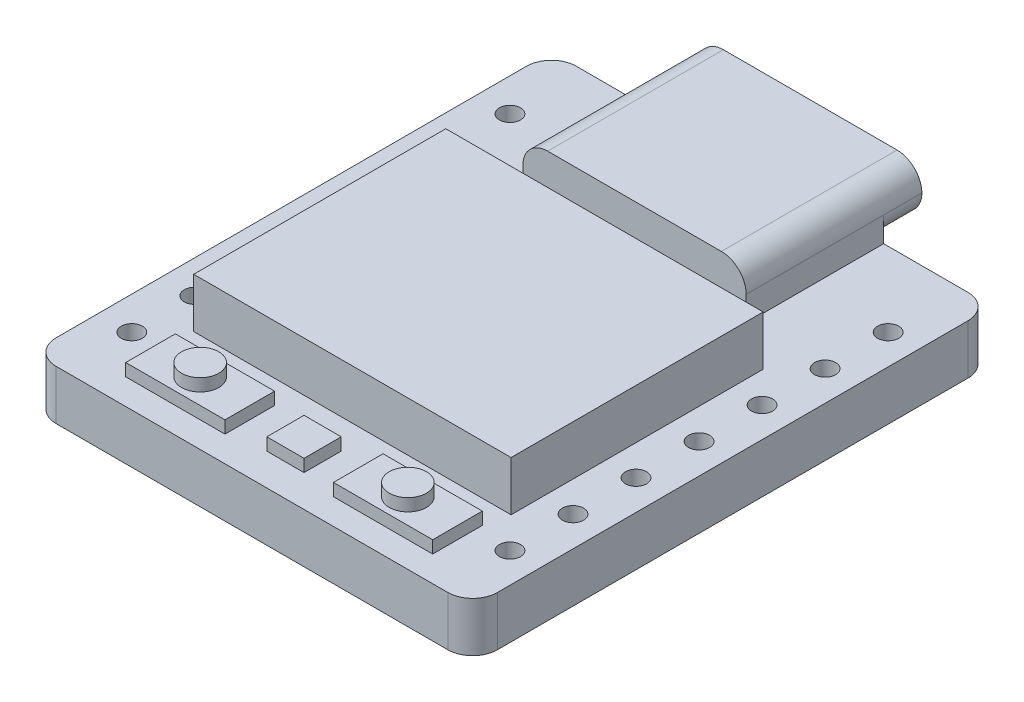
from build123d import *

# Parameters (mm, degrees)
ESQUISSE1_W             = 17.78
ESQUISSE1_H             = 20.955
ESQUISSE1_R             = 0.425
BOSS_EXTRU_1_DEPTH      = 2
BOSS_EXTRU_2_DEPTH      = 2
CONG_1_R                = 1
ESQUISSE3_W             = 6.499332414
ESQUISSE3_H             = 0.15
ENL_V_MAT_EXTRU_1_DEPTH = 4
CONG_2_R                = 1
ESQUISSE4_W             = 12.79
ESQUISSE4_H             = 10.16
BOSS_EXTRU_3_DEPTH      = 2
ESQUISSE5_W             = 4
ESQUISSE5_H             = 2
ESQUISSE5_W_2           = 1.5
ESQUISSE5_H_2           = 1.5
BOSS_EXTRU_4_DEPTH      = 0.5
ESQUISSE6_R             = 0.75
BOSS_EXTRU_5_DEPTH      = 0.5


with BuildPart() as part:
    # Esquisse1 → Boss.-Extru.1 (new body)
    with BuildSketch(Plane(origin=(0, 0, 0), x_dir=(1, 0, 0), z_dir=(0, 1, 0))):
        Rectangle(ESQUISSE1_W, ESQUISSE1_H)
        with Locations(Location((-7.56, 7.4775, 0), (0, 0, 270))):
            Circle(ESQUISSE1_R, mode=Mode.SUBTRACT)
        with Locations(Location((7.68, 7.4775, 0), (0, 0, 270))):
            Circle(ESQUISSE1_R, mode=Mode.SUBTRACT)
        with Locations(Location((7.68, 4.9375, 0), (0, 0, 270))):
            Circle(ESQUISSE1_R, mode=Mode.SUBTRACT)
        with Locations(Location((7.68, 2.3975, 0), (0, 0, 270))):
            Circle(ESQUISSE1_R, mode=Mode.SUBTRACT)
        with Locations(Location((7.68, -0.1425, 0), (0, 0, 270))):
            Circle(ESQUISSE1_R, mode=Mode.SUBTRACT)
        with Locations(Location((7.68, -2.6825, 0), (0, 0, 270))):
            Circle(ESQUISSE1_R, mode=Mode.SUBTRACT)
        with Locations(Location((7.68, -5.2225, 0), (0, 0, 270))):
            Circle(ESQUISSE1_R, mode=Mode.SUBTRACT)
        with Locations(Location((7.68, -7.7625, 0), (0, 0, 270))):
            Circle(ESQUISSE1_R, mode=Mode.SUBTRACT)
        with Locations(Location((-7.56, 4.9375, 0), (0, 0, 270))):
            Circle(ESQUISSE1_R, mode=Mode.SUBTRACT)
        with Locations(Location((-7.56, 2.3975, 0), (0, 0, 270))):
            Circle(ESQUISSE1_R, mode=Mode.SUBTRACT)
        with Locations(Location((-7.56, -0.1425, 0), (0, 0, 270))):
            Circle(ESQUISSE1_R, mode=Mode.SUBTRACT)
        with Locations(Location((-7.56, -2.6825, 0), (0, 0, 270))):
            Circle(ESQUISSE1_R, mode=Mode.SUBTRACT)
        with Locations(Location((-7.56, -5.2225, 0), (0, 0, 270))):
            Circle(ESQUISSE1_R, mode=Mode.SUBTRACT)
        with Locations(Location((-7.56, -7.7625, 0), (0, 0, 270))):
            Circle(ESQUISSE1_R, mode=Mode.SUBTRACT)
    extrude(amount=BOSS_EXTRU_1_DEPTH)

    # Esquisse2 → Boss.-Extru.2 (add)
    with BuildSketch(Plane(origin=(0, 2, 0), x_dir=(1, 0, 0), z_dir=(0, 1, 0))):
        Polygon((-4.5, 12.0175), (4.5, 12.0175), (4.5, 7.4775), (4.5, 4.9375), (-4.5, 4.9375), (-4.5, 7.4775), align=None)
    extrude(amount=BOSS_EXTRU_2_DEPTH)

    # Congé1
    cong_1_edges = [part.edges().sort_by_distance(p)[0] for p in [
        (-4.5, 2, -11.2475),
        (4.5, 2, -11.2475),
        (-4.5, 4, -8.4775),
        (4.5, 4, -8.4775),
    ]]
    fillet(cong_1_edges, radius=CONG_1_R - 0.0001)  # a hair under: the kernel refuses the full size

    # Esquisse3 → Enlèv. mat.-Extru.1 (cut)
    with BuildSketch(Plane(origin=(0, 0, -12.0175), x_dir=(-1, 0, 0), z_dir=(0, 0, -1))):
        with BuildLine():
            ThreePointArc((-3.708196785, 2.958530578), (-3.568140241, 2.640056544), (-3.249666207, 2.5))
            Line((-3.249666207, 2.5), (3.249666207, 2.5))
            ThreePointArc((3.249666207, 2.5), (3.568140241, 2.640056544), (3.708196785, 2.958530578))
            Line((3.708196785, 2.958530578), (3.708196785, 3))
            Line((3.708196785, 3), (3.708196785, 3.041469422))
            ThreePointArc((3.708196785, 3.041469422), (3.568140241, 3.359943456), (3.249666207, 3.5))
            Line((3.249666207, 3.5), (-3.249666207, 3.5))
            ThreePointArc((-3.249666207, 3.5), (-3.568140241, 3.359943456), (-3.708196785, 3.041469422))
            Line((-3.708196785, 3.041469422), (-3.708196785, 3))
            Line((-3.708196785, 3), (-3.708196785, 2.958530578))
        make_face()
        with Locations((0, 3)):
            Rectangle(ESQUISSE3_W, ESQUISSE3_H, mode=Mode.SUBTRACT)
    extrude(amount=-ENL_V_MAT_EXTRU_1_DEPTH, mode=Mode.SUBTRACT)

    # Congé2
    cong_2_edges = [part.edges().sort_by_distance(p)[0] for p in [
        (8.89, 1, 10.4775),
        (-8.89, 1, 10.4775),
        (-8.89, 1, -10.4775),
        (8.89, 1, -10.4775),
    ]]
    fillet(cong_2_edges, radius=CONG_2_R)

    # Esquisse4 → Boss.-Extru.3 (add)
    with BuildSketch(Plane(origin=(0, 2, 0), x_dir=(1, 0, 0), z_dir=(0, 1, 0))):
        with Locations((0.06, -1.4125)):
            Rectangle(ESQUISSE4_W, ESQUISSE4_H)
    extrude(amount=BOSS_EXTRU_3_DEPTH)

    # Esquisse5 → Boss.-Extru.4 (add)
    with BuildSketch(Plane(origin=(0, 2, 0), x_dir=(1, 0, 0), z_dir=(0, 1, 0))):
        with Locations((-4.125, -8.44125)):
            Rectangle(ESQUISSE5_W, ESQUISSE5_H)
        with Locations((4.245, -8.44125)):
            Rectangle(ESQUISSE5_W, ESQUISSE5_H)
        with Locations((0.06, -8.44125)):
            Rectangle(ESQUISSE5_W_2, ESQUISSE5_H_2)
    extrude(amount=BOSS_EXTRU_4_DEPTH)

    # Esquisse6 → Boss.-Extru.5 (add)
    with BuildSketch(Plane(origin=(0, 2.5, 0), x_dir=(1, 0, 0), z_dir=(0, 1, 0))):
        with Locations(Location((-4.125, -8.44125, 0), (0, 0, 270))):
            Circle(ESQUISSE6_R)
        with Locations(Location((4.245, -8.44125, 0), (0, 0, 90))):
            Circle(ESQUISSE6_R)
    extrude(amount=BOSS_EXTRU_5_DEPTH)


solid = part.part
